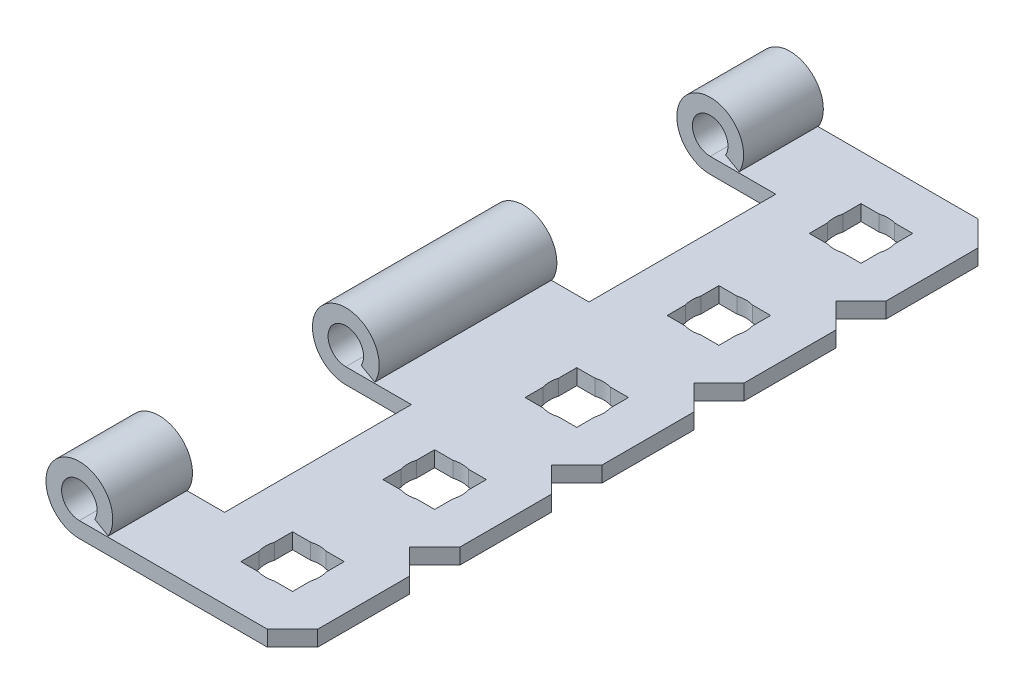
from build123d import *

# Parameters (mm, degrees)
BOSS_EXTRUDE1_START       = -15.875
BOSS_EXTRUDE1_DEPTH       = 15.875
BOSS_EXTRUDE1_2_OUTLINE_W = 13.197490677
BOSS_EXTRUDE1_2_OUTLINE_H = 1.397
BOSS_EXTRUDE1_2_DEPTH     = 16.6878
SKETCH2_W                 = 13.197490677
SKETCH2_H                 = 1.397
BOSS_EXTRUDE2_DEPTH       = 16.6878
BOSS_EXTRUDE3_START       = 7.1247
BOSS_EXTRUDE3_DEPTH       = 7.1247
BOSS_EXTRUDE4_DEPTH       = 7.1247
CUT_EXTRUDE1_DEPTH        = 38.210837465
CUT_EXTRUDE2_DEPTH        = 38.210837465
CUT_EXTRUDE3_DEPTH        = 38.210837465
CUT_EXTRUDE4_DEPTH        = 38.210837465
SKETCH9_W                 = 4.6228
SKETCH9_H                 = 4.6228
CUT_EXTRUDE5_DEPTH        = 38.408183622
SKETCH10_W                = 4.6228
SKETCH10_H                = 4.6228
CUT_EXTRUDE6_DEPTH        = 38.408183622
SKETCH11_W                = 4.6228
SKETCH11_H                = 4.6228
CUT_EXTRUDE7_DEPTH        = 38.408183622
SKETCH12_W                = 4.6228
SKETCH12_H                = 4.6228
CUT_EXTRUDE8_DEPTH        = 38.408183622
SKETCH13_W                = 4.6228
SKETCH13_H                = 4.6228
CUT_EXTRUDE9_DEPTH        = 38.210837465
DRAFT1_DEPTH              = 1.397
DRAFT2_DEPTH              = 1.397
CHAMFER1_SIZE             = 2.24506403
SKETCH14_R                = 2.413
CUT_EXTRUDE10_DEPTH       = 2.54
LPATTERN1_COUNT           = 5
LPATTERN1_PITCH           = 12.7


with BuildPart() as part:
    # Boss-Extrude1: read off the stored shape, not the designer's step
    # Boss-Extrude1 outline → Boss-Extrude1 (new body)
    with BuildSketch(Plane.XY.offset(7.9375).offset(BOSS_EXTRUDE1_START)):
        with BuildLine():
            Line((-14.500184662, 2.190749994), (-13.290347173, 1.492249994))
            ThreePointArc((-13.290347173, 1.492249994), (-17.367250005, 5.569152828), (-15.875, -1.1e-08))
            Line((-15.875, -1.1e-08), (3.175, 0))
            Line((3.175, 0), (3.175, 1.397))
            Line((3.175, 1.397), (-15.875, 1.396999989))
            ThreePointArc((-15.875, 1.396999989), (-16.668750005, 4.359315339), (-14.500184662, 2.190749994))
        make_face()
    extrude(amount=BOSS_EXTRUDE1_DEPTH)

    # Boss-Extrude1 2 outline → Boss-Extrude1 2 (add)
    with BuildSketch(Plane.XY.offset(7.9375)):
        with Locations((-3.423745338, 0.6985)):
            Rectangle(BOSS_EXTRUDE1_2_OUTLINE_W, BOSS_EXTRUDE1_2_OUTLINE_H)
    extrude(amount=BOSS_EXTRUDE1_2_DEPTH)

    # Sketch2 → Boss-Extrude2 (add)
    with BuildSketch(Plane(origin=(0, 0, -7.9375), x_dir=(-1, 0, 0), z_dir=(0, 0, -1))):
        with Locations((3.423745338, 0.6985)):
            Rectangle(SKETCH2_W, SKETCH2_H)
    extrude(amount=BOSS_EXTRUDE2_DEPTH)

    # Sketch3 → Boss-Extrude3 (add)
    with BuildSketch(Plane(origin=(0, 0, -24.6253), x_dir=(-1, 0, 0), z_dir=(0, 0, -1)).offset(BOSS_EXTRUDE3_START)):
        with BuildLine():
            Line((15.875, 0), (-3.175, 0))
            Line((-3.175, 0), (-3.175, 1.397))
            Line((-3.175, 1.397), (15.875, 1.397))
            ThreePointArc((15.875, 1.397), (16.668750004, 4.359315344), (14.500184664, 2.190750004))
            Line((14.500184664, 2.190750004), (13.290347175, 1.492250004))
            ThreePointArc((13.290347175, 1.492250004), (17.367250004, 5.569152833), (15.875, 0))
        make_face()
    extrude(amount=-BOSS_EXTRUDE3_DEPTH)

    # Sketch4 → Boss-Extrude4 (add)
    with BuildSketch(Plane.XY.offset(24.6253)):
        with BuildLine():
            Line((-15.875, 1.396999994), (3.175, 1.396999994))
            Line((3.175, 1.396999994), (3.175, -6e-09))
            Line((3.175, -6e-09), (-15.875, -6e-09))
            ThreePointArc((-15.875, -6e-09), (-17.367250004, 5.569152828), (-13.290347175, 1.492249999))
            Line((-13.290347175, 1.492249999), (-14.500184664, 2.190749999))
            ThreePointArc((-14.500184664, 2.190749999), (-16.668750004, 4.359315339), (-15.875, 1.396999994))
        make_face()
    extrude(amount=BOSS_EXTRUDE4_DEPTH)

    # Sketch5 → Cut-Extrude1 (cut, through all)
    with BuildSketch(Plane(origin=(0, 1.397, 0), x_dir=(-1, 0, 0), z_dir=(0, 1, 0))):
        Polygon((-3.175, -16.80493597), (-3.175, -21.29506403), (1.315128061, -16.80493597), align=None)
    extrude(amount=-CUT_EXTRUDE1_DEPTH, mode=Mode.SUBTRACT)

    # Sketch6 → Cut-Extrude2 (cut, through all)
    with BuildSketch(Plane(origin=(0, 1.397, 0), x_dir=(-1, 0, 0), z_dir=(0, 1, 0))):
        Polygon((-3.175, -4.10493597), (-3.175, -8.59506403), (1.315128061, -8.59506403), align=None)
    extrude(amount=-CUT_EXTRUDE2_DEPTH, mode=Mode.SUBTRACT)

    # Sketch7 → Cut-Extrude3 (cut, through all)
    with BuildSketch(Plane(origin=(0, 1.397, 0), x_dir=(-1, 0, 0), z_dir=(0, 1, 0))):
        Polygon((-3.175, 8.59506403), (-3.175, 4.10493597), (1.315128061, 8.59506403), align=None)
    extrude(amount=-CUT_EXTRUDE3_DEPTH, mode=Mode.SUBTRACT)

    # Sketch8 → Cut-Extrude4 (cut, through all)
    with BuildSketch(Plane(origin=(0, 1.397, 0), x_dir=(-1, 0, 0), z_dir=(0, 1, 0))):
        Polygon((-3.175, 21.29506403), (-3.175, 16.80493597), (1.315128061, 16.80493597), align=None)
    extrude(amount=-CUT_EXTRUDE4_DEPTH, mode=Mode.SUBTRACT)

    # Sketch9 → Cut-Extrude5 (cut, through all)
    with BuildSketch(Plane.XZ):
        with Locations((-3.175, 25.4)):
            Rectangle(SKETCH9_W, SKETCH9_H)
    extrude(amount=-CUT_EXTRUDE5_DEPTH, mode=Mode.SUBTRACT)

    # Sketch10 → Cut-Extrude6 (cut, through all)
    with BuildSketch(Plane.XZ):
        with Locations((-3.175, 12.7)):
            Rectangle(SKETCH10_W, SKETCH10_H)
    extrude(amount=-CUT_EXTRUDE6_DEPTH, mode=Mode.SUBTRACT)

    # Sketch11 → Cut-Extrude7 (cut, through all)
    with BuildSketch(Plane.XZ):
        with Locations((-3.175, 0)):
            Rectangle(SKETCH11_W, SKETCH11_H)
    extrude(amount=-CUT_EXTRUDE7_DEPTH, mode=Mode.SUBTRACT)

    # Sketch12 → Cut-Extrude8 (cut, through all)
    with BuildSketch(Plane.XZ):
        with Locations((-3.175, -12.7)):
            Rectangle(SKETCH12_W, SKETCH12_H)
    extrude(amount=-CUT_EXTRUDE8_DEPTH, mode=Mode.SUBTRACT)

    # Sketch13 → Cut-Extrude9 (cut, through all)
    with BuildSketch(Plane(origin=(0, 1.397, 0), x_dir=(-1, 0, 0), z_dir=(0, 1, 0))):
        with Locations((3.175, -25.4)):
            Rectangle(SKETCH13_W, SKETCH13_H)
    extrude(amount=-CUT_EXTRUDE9_DEPTH, mode=Mode.SUBTRACT)

    # Draft1: read off the stored shape, not the designer's step
    # Draft1 outline → Draft1 (add)
    with BuildSketch(Plane(origin=(0, 0, 0), x_dir=(1, 0, 0), z_dir=(0, 1, 0))):
        Polygon((-1.315128061, 16.80493597), (3.175, 16.80493597), (0.92993597, 19.05), align=None)
        Polygon((-1.315128061, 8.59506403), (0.92993597, 6.35), (3.175, 8.59506403), align=None)
    extrude(amount=DRAFT1_DEPTH)

    # Draft2: read off the stored shape, not the designer's step
    # Draft2 outline → Draft2 (add)
    with BuildSketch(Plane(origin=(0, 0, 0), x_dir=(1, 0, 0), z_dir=(0, 1, 0))):
        Polygon((-1.315128061, -8.59506403), (3.175, -8.59506403), (0.92993597, -6.35), align=None)
        Polygon((-1.315128061, -16.80493597), (0.92993597, -19.05), (3.175, -16.80493597), align=None)
    extrude(amount=DRAFT2_DEPTH)

    # Chamfer1
    chamfer1_edges = [part.edges().sort_by_distance(p)[0] for p in [
        (3.175, 0.6985, -31.75),
        (3.175, 0.698499994, 31.75),
    ]]
    chamfer(chamfer1_edges, length=CHAMFER1_SIZE)

    # Sketch14 → Cut-Extrude10 (cut)
    with BuildSketch(Plane(origin=(0, 1.397, 0), x_dir=(1, 0, 0), z_dir=(0, 1, 0))):
        with Locations((-3.175, -25.4)):
            Circle(SKETCH14_R)
    cut_extrude10 = extrude(amount=-CUT_EXTRUDE10_DEPTH, mode=Mode.SUBTRACT)

    # LPattern1: Cut-Extrude10 ×5
    with Locations(*[(0, 0, -i * LPATTERN1_PITCH) for i in range(1, LPATTERN1_COUNT)]):
        add(cut_extrude10, mode=Mode.SUBTRACT)


solid = part.part
